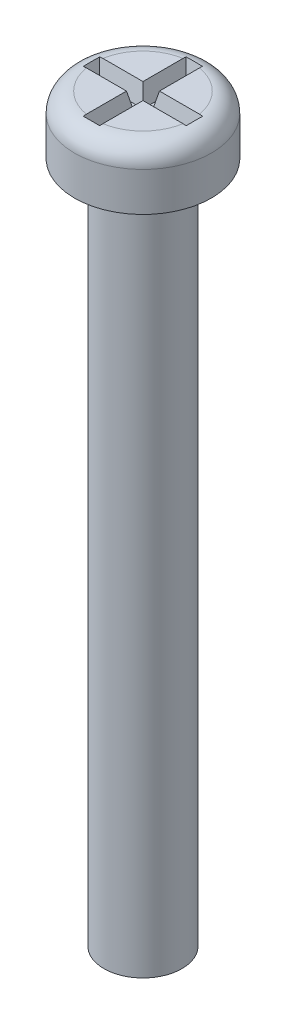
from build123d import *

# Parameters (mm, degrees)
SKETCH_1_R          = 2
EXTRUDE_1_DEPTH     = 35
SKETCH_2_R          = 3.515
EXTRUDE_2_DEPTH     = 3
CUT_EXTRUDE_1_DEPTH = 1
CUT_EXTRUDE_1_DRAFT = -12
FILLET_2_R          = 1


with BuildPart() as part:
    # Эскиз1 → Бобышка-Вытянуть1 (new body)
    with BuildSketch(Plane(origin=(0, 0, 0), x_dir=(1, 0, 0), z_dir=(0, 1, 0))):
        with Locations(Location((0, 0, 0), (0, 0, 270))):
            Circle(SKETCH_1_R)
    extrude(amount=EXTRUDE_1_DEPTH)

    # Эскиз2 → Бобышка-Вытянуть2 (add)
    with BuildSketch(Plane(origin=(0, 35, 0), x_dir=(1, 0, 0), z_dir=(0, 1, 0))):
        with Locations(Location((0, 0, 0), (0, 0, 270))):
            Circle(SKETCH_2_R)
    extrude(amount=EXTRUDE_2_DEPTH)


with BuildPart() as cut_extrude_1_tool:
    # Эскиз3 → Вырез-Вытянуть1 (with draft: the straight prism first)
    with BuildSketch(Plane(origin=(0, 38, 0), x_dir=(1, 0, 0), z_dir=(0, 1, 0))):
        Polygon((-2.641549473, 0.422769916), (-2.641549473, -0.422769916), (-0.422769916, -0.422769916), (-0.422769916, -2.641549473), (0.422769916, -2.641549473), (0.422769916, -0.422769916), (2.641549473, -0.422769916), (2.641549473, 0.422769916), (0.422769916, 0.422769916), (0.422769916, 2.641549473), (-0.422769916, 2.641549473), (-0.422769916, 0.422769916), align=None)
    extrude(amount=-CUT_EXTRUDE_1_DEPTH)
    # Вырез-Вытянуть1: the draft: its side faces are tilted about the plane it starts from
    cut_extrude_1_sides = [cut_extrude_1_tool.faces().sort_by_distance(p)[0] for p in [
        (-2.641549473, 37.5, 0),
        (-1.532159694, 37.5, 0.422769916),
        (-0.422769916, 37.5, 1.532159694),
        (0, 37.5, 2.641549473),
        (0.422769916, 37.5, 1.532159694),
        (1.532159694, 37.5, 0.422769916),
        (2.641549473, 37.5, 0),
        (1.532159694, 37.5, -0.422769916),
        (0.422769916, 37.5, -1.532159694),
        (0, 37.5, -2.641549473),
        (-0.422769916, 37.5, -1.532159694),
        (-1.532159694, 37.5, -0.422769916),
    ]]
    draft(cut_extrude_1_sides, Plane(origin=(0, 38, 0), x_dir=(1, 0, 0), z_dir=(0, 1, 0)), CUT_EXTRUDE_1_DRAFT)


with BuildPart() as part_1:
    add(part.part)

    # Вырез-Вытянуть1: cut by cut_extrude_1_tool
    add(cut_extrude_1_tool.part, mode=Mode.SUBTRACT)

    # Скругление2
    # the kernel refuses this fillet: 1 mm, written as the material it takes off along each edge
    with BuildSketch(Plane(origin=(0, 38, 0), x_dir=(0, 0, 1), z_dir=(-1, 0, 0))) as fillet_2_piece_1:
        with BuildLine():
            CenterArc((3.515 - FILLET_2_R, -FILLET_2_R), FILLET_2_R, 0, 90)
            Line((3.515 - FILLET_2_R, 0), (3.515, 0))
            Line((3.515, 0), (3.515, -FILLET_2_R))
        make_face()
    revolve(axis=Axis((0, 38, 0), (0, 1, 0)), mode=Mode.SUBTRACT)


solid = part_1.part
